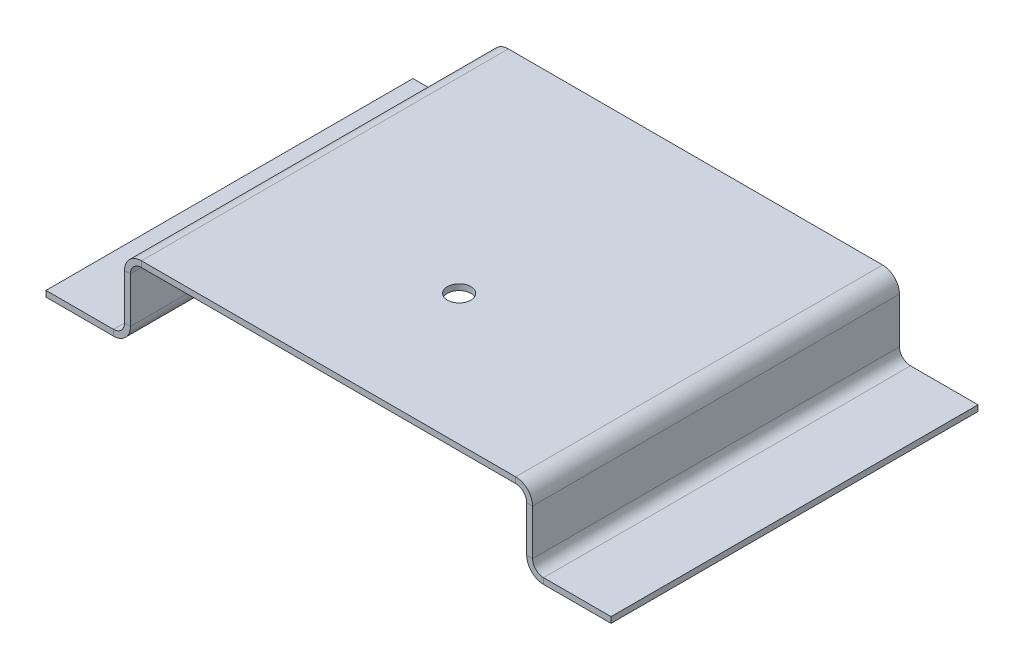
from build123d import *

# Parameters (mm, degrees)
BASE_FLANGE1_DEPTH = 25
SKETCH2_R          = 1.6
CUT_EXTRUDE1_DEPTH = 10


# Sheet-metal steps are written as plain solids
with BuildPart() as part:
    # Sketch1 → Base-Flange1 (new, symmetric)
    with BuildSketch(Plane.XY):
        with BuildLine():
            Line((-38.5, -10), (-29.3, -10))
            ThreePointArc((-29.3, -10), (-27.673654403, -9.326345597), (-27, -7.7))
            Line((-27, -7.7), (-27, -1.5))
            ThreePointArc((-27, -1.5), (-26.560660172, -0.439339828), (-25.5, 0))
            Line((-25.5, 0), (25.5, 0))
            ThreePointArc((25.5, 0), (26.560660172, -0.439339828), (27, -1.5))
            Line((27, -1.5), (27, -7.7))
            ThreePointArc((27, -7.7), (27.673654403, -9.326345597), (29.3, -10))
            Line((29.3, -10), (38.5, -10))
            Line((38.5, -10), (38.5, -9.2))
            Line((38.5, -9.2), (29.3, -9.2))
            ThreePointArc((29.3, -9.2), (28.239339828, -8.760660172), (27.8, -7.7))
            Line((27.8, -7.7), (27.8, -1.5))
            ThreePointArc((27.8, -1.5), (27.126345597, 0.126345597), (25.5, 0.8))
            Line((25.5, 0.8), (-25.5, 0.8))
            ThreePointArc((-25.5, 0.8), (-27.126345597, 0.126345597), (-27.8, -1.5))
            Line((-27.8, -1.5), (-27.8, -7.7))
            ThreePointArc((-27.8, -7.7), (-28.239339828, -8.760660172), (-29.3, -9.2))
            Line((-29.3, -9.2), (-38.5, -9.2))
            Line((-38.5, -9.2), (-38.5, -10))
        make_face()
    extrude(amount=BASE_FLANGE1_DEPTH, both=True)

    # Sketch2 → Cut-Extrude1 (cut)
    with BuildSketch(Plane(origin=(0, 0.8, 0), x_dir=(1, 0, 0), z_dir=(0, 1, 0))):
        with Locations(Location((0, -7.2, 0), (0, 0, 270))):
            Circle(SKETCH2_R)
    extrude(amount=-CUT_EXTRUDE1_DEPTH, mode=Mode.SUBTRACT)


solid = part.part
